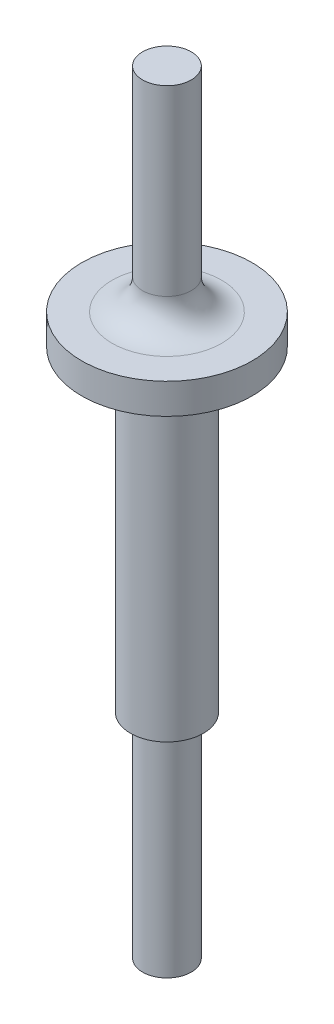
from build123d import *

# Parameters (mm, degrees)
FILLET1_R = 5
FILLET2_R = 2


with BuildPart() as part:
    # Sketch1 → Revolve1 (revolve)
    with BuildSketch(Plane.XY, mode=Mode.PRIVATE) as revolve1_sk:
        Polygon((6.178218081, 62.486265198), (6.178218081, 27.486265198), (16.178218081, 27.486265198), (16.178218081, 22.486265198), (8.178218081, 22.486265198), (8.178218081, -29.513734802), (6.178218081, -29.513734802), (6.178218081, -64.513734802), (2.178218081, -64.513734802), (2.178218081, 62.486265198), align=None)
    revolve(revolve1_sk.sketch.rotate(Axis((2.178218081, 62.486265198, 0), (0, -1, 0)), 180), axis=Axis((2.178218081, 62.486265198, 0), (0, -1, 0)))

    # Fillet1
    fillet1_edges = [part.edges().sort_by_distance(p)[0] for p in [
        (6.178218081, 27.486265198, 0),
    ]]
    fillet(fillet1_edges, radius=FILLET1_R)

    # Fillet2
    fillet2_edges = [part.edges().sort_by_distance(p)[0] for p in [
        (8.178218081, 22.486265198, 0),
    ]]
    fillet(fillet2_edges, radius=FILLET2_R)

    # Fillet3: read off the stored shape, not the designer's step
    # Fillet3 outline → Fillet3 (revolve)
    with BuildSketch(Plane(origin=(2.178218081, 0, 0), x_dir=(1, 0, 0), z_dir=(0, 0, 1))):
        with BuildLine():
            Line((4, -29.513734802), (4, -30.927948365))
            ThreePointArc((4, -30.927948365), (4.414213562, -29.927948365), (5.414213562, -29.513734802))
            Line((5.414213562, -29.513734802), (4, -29.513734802))
        make_face()
    revolve(axis=Axis((2.178218081, 0, 0), (0, 1, 0)))


solid = part.part
